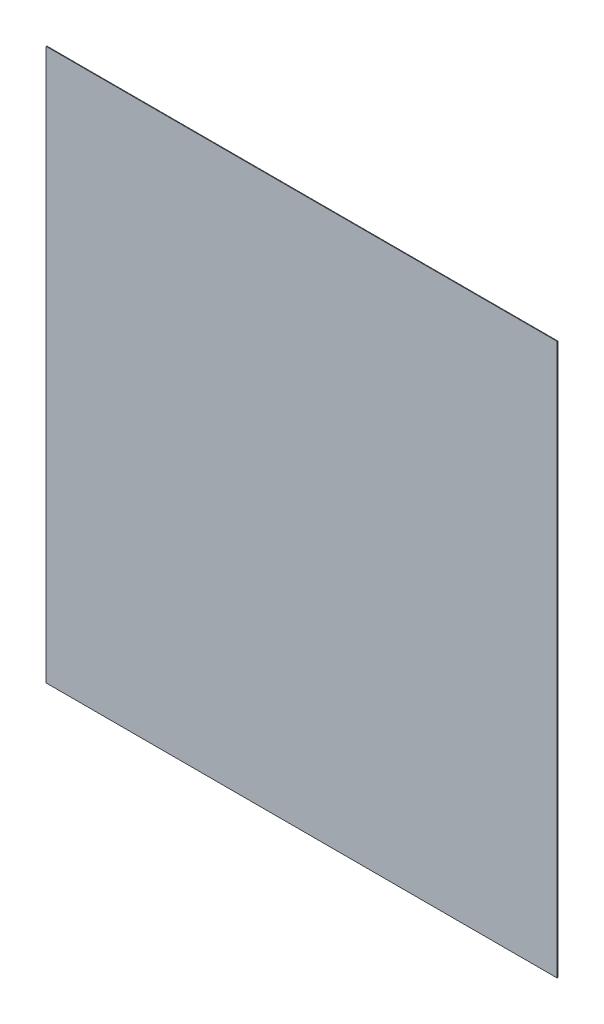
from build123d import *

# Parameters (mm, degrees)
SKETCH1_W          = 12000
SKETCH1_H          = 12950
BASE_FLANGE1_DEPTH = 15


# Sheet-metal steps are written as plain solids
with BuildPart() as part:
    # Sketch1 → Base-Flange1 (new body)
    with BuildSketch(Plane.XY):
        with Locations((6000, 6475)):
            Rectangle(SKETCH1_W, SKETCH1_H)
    extrude(amount=BASE_FLANGE1_DEPTH)


solid = part.part
